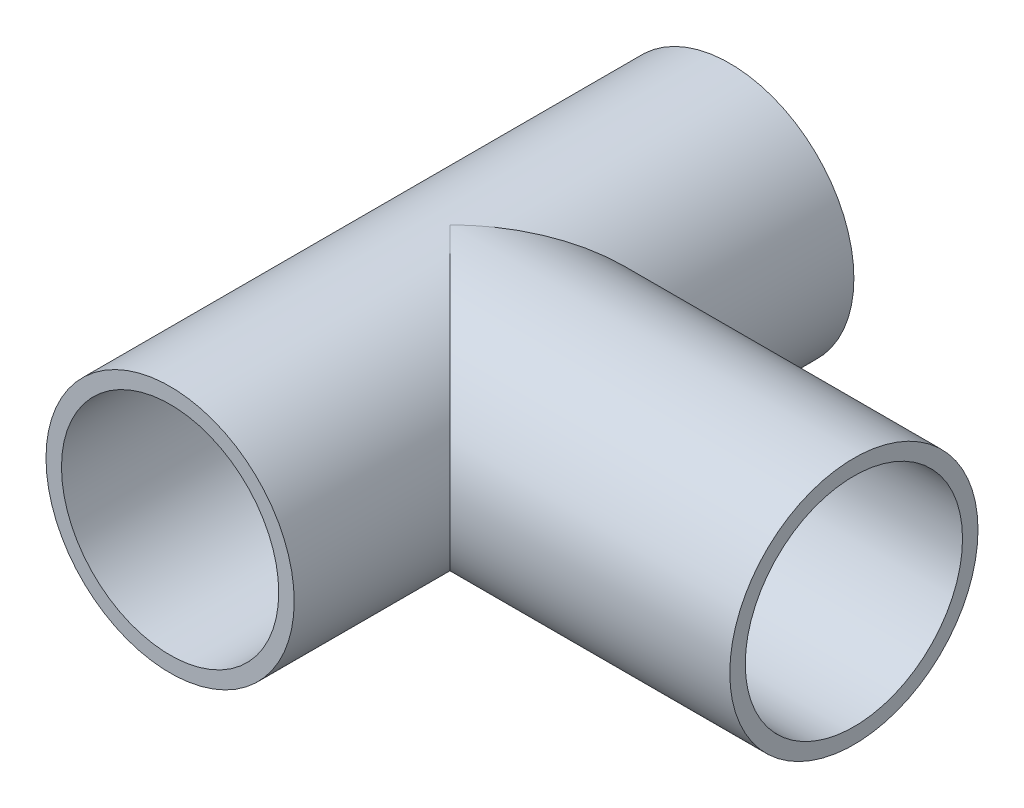
from build123d import *

# Parameters (mm, degrees)
THROUGH_SECTION_R                        = 161.925
THROUGH_SECTION_R_2                      = 141.732
THROUGH_SECTION_EXTRUDE_DEPTH            = 365.125
ORTHOGONAL_SECTION_OD_EXTRUDE_REACH      = 798.381
ORTHOGONAL_SECTION_OD_EXTRUDE_END_RADIUS = 161.925
ORTHOGONAL_SECTION_OD_R                  = 161.925
ORTHOGONAL_SECTION_ID_CUT_REACH          = 798.381
ORTHOGONAL_SECTION_ID_R                  = 141.732


with BuildPart() as part:
    # Through Section → Through Section Extrude (new, symmetric)
    with BuildSketch(Plane.XY):
        Circle(THROUGH_SECTION_R)
        Circle(THROUGH_SECTION_R_2, mode=Mode.SUBTRACT)
    extrude(amount=THROUGH_SECTION_EXTRUDE_DEPTH, both=True)

    # Orthogonal Section OD Extrude: up to this cylinder (the profile starts outside it)
    orthogonal_section_od_extrude_end = Plane(origin=(0, 0, 0), z_dir=(0, 0, -1)) * Cylinder(ORTHOGONAL_SECTION_OD_EXTRUDE_END_RADIUS, 1921.612, mode=Mode.PRIVATE)
    # Orthogonal Section OD → Orthogonal Section OD Extrude (add, up to the surface)
    with BuildSketch(Plane(origin=(527.05, 0, 0), x_dir=(0, 0, -1), z_dir=(1, 0, 0)), mode=Mode.PRIVATE) as orthogonal_section_od_extrude_sk1:
        Circle(ORTHOGONAL_SECTION_OD_R)
    orthogonal_section_od_extrude_tool1 = extrude(orthogonal_section_od_extrude_sk1.sketch, amount=-ORTHOGONAL_SECTION_OD_EXTRUDE_REACH, mode=Mode.PRIVATE) - orthogonal_section_od_extrude_end
    add(orthogonal_section_od_extrude_tool1.solids().sort_by_distance((527.05, 0, 0))[0])

    # Orthogonal Section ID → Orthogonal Section ID Cut (cut, up to next)
    with BuildSketch(Plane(origin=(527.05, 0, 0), x_dir=(0, 0, -1), z_dir=(1, 0, 0)), mode=Mode.PRIVATE) as orthogonal_section_id_cut_sk1:
        Circle(ORTHOGONAL_SECTION_ID_R)
    orthogonal_section_id_cut_tool1 = extrude(orthogonal_section_id_cut_sk1.sketch, amount=-ORTHOGONAL_SECTION_ID_CUT_REACH, mode=Mode.PRIVATE) & part.part
    add(orthogonal_section_id_cut_tool1.solids().sort_by_distance((527.05, 0, 0))[0], mode=Mode.SUBTRACT)


solid = part.part
